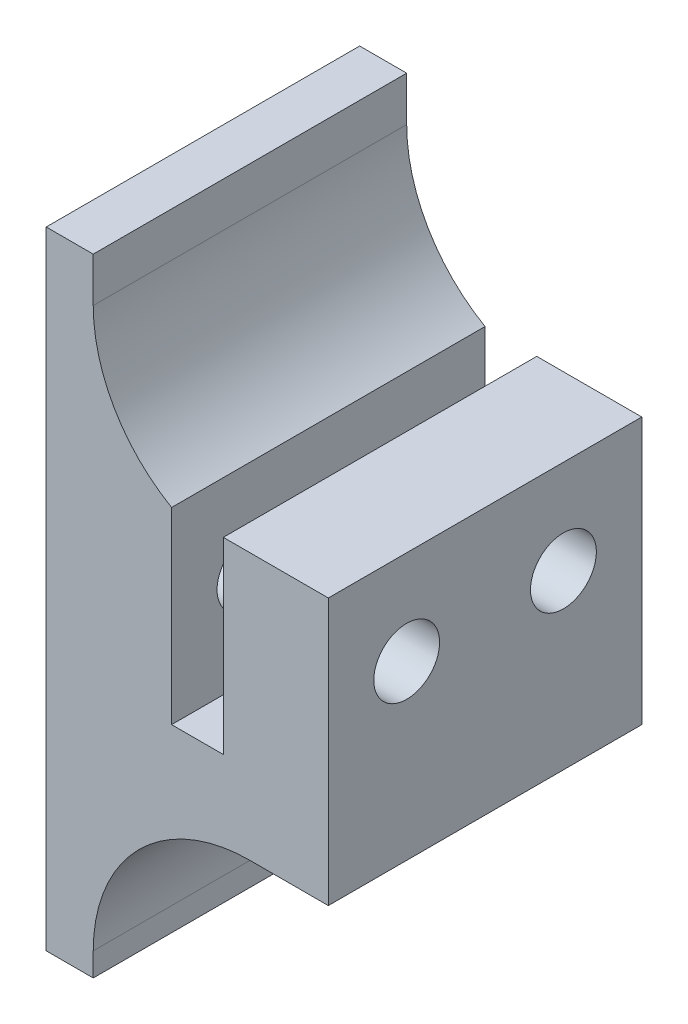
from build123d import *

# Parameters (mm, degrees)
EXTRUDE_1_DEPTH     = 20
FILLET_1_R          = 10
SKETCH_2_R          = 2.1
CUT_EXTRUDE_1_DEPTH = 40.195025195


with BuildPart() as part:
    # 草图1 → 凸台-拉伸1 (new body)
    with BuildSketch(Plane.XY):
        Polygon((3.3, 0), (10, 0), (10, -17), (0, -17), (-5, -17), (-5, -28.5), (-8, -28.5), (-8, 11.5), (-5, 11.5), (-5, 0), (0, 0), (0, -12), (3.3, -12), align=None)
    extrude(amount=EXTRUDE_1_DEPTH)

    # 圆角1
    # the kernel refuses this fillet: 10 mm, written as the material it adds along each edge
    with BuildSketch(Plane(origin=(-5, -17, 0), x_dir=(0, -1, 0), z_dir=(0, 0, 1))) as fillet_1_piece_1:
        with BuildLine():
            CenterArc((FILLET_1_R, FILLET_1_R), FILLET_1_R, 180, 90)
            Line((0, FILLET_1_R), (-FILLET_1_R * 0.02, FILLET_1_R))
            Line((-FILLET_1_R * 0.02, FILLET_1_R), (-FILLET_1_R * 0.02, -FILLET_1_R * 0.02))
            Line((-FILLET_1_R * 0.02, -FILLET_1_R * 0.02), (FILLET_1_R, -FILLET_1_R * 0.02))
            Line((FILLET_1_R, -FILLET_1_R * 0.02), (FILLET_1_R, 0))
        make_face()
    extrude(amount=20)
    with BuildSketch(Plane(origin=(-5, 0, 0), x_dir=(1, 0, 0), z_dir=(0, 0, 1))) as fillet_1_piece_2:
        with BuildLine():
            CenterArc((10, 8.660254038), FILLET_1_R, 180, 60)
            Line((0, 8.660254038), (-0.2, 8.660254038))
            Line((-0.2, 8.660254038), (-0.2, 0))
            Line((-0.2, 0), (0, -0.2))
            ThreePointArc((0, -0.2), (2.5, -0.2), (4.9, -0.173205081))
            Line((4.9, -0.173205081), (5, 0))
        make_face()
    extrude(amount=20)

    # 草图2 → 切除-拉伸1 (cut, through all)
    with BuildSketch(Plane.ZY.offset(8)):
        with Locations((5, -6)):
            Circle(SKETCH_2_R)
        with Locations((15, -6)):
            Circle(SKETCH_2_R)
    extrude(amount=-CUT_EXTRUDE_1_DEPTH, mode=Mode.SUBTRACT)


solid = part.part
